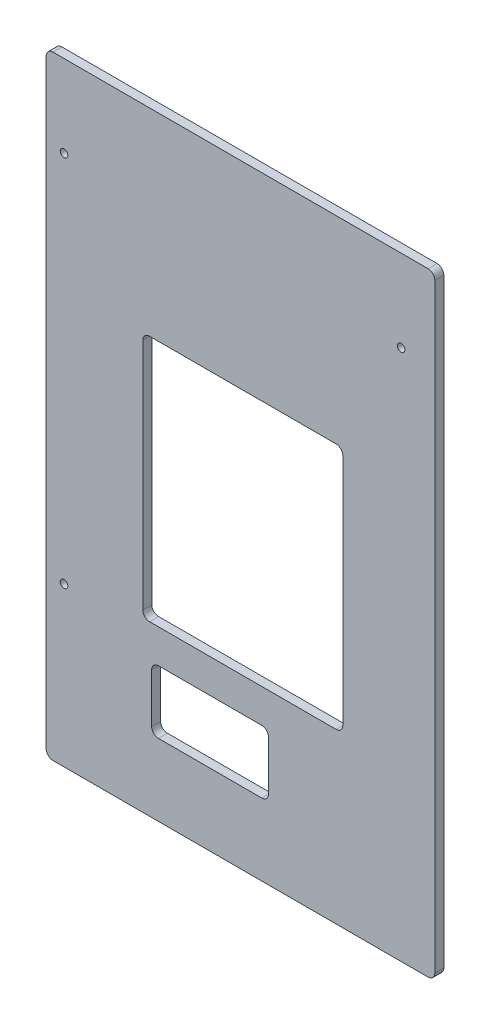
from build123d import *

# Parameters (mm, degrees)
ESQUISSE1_W        = 172.93
ESQUISSE1_H        = 273
ESQUISSE1_R        = 1.5
ESQUISSE1_W_2      = 89
ESQUISSE1_H_2      = 110
ESQUISSE1_W_3      = 52
ESQUISSE1_H_3      = 28
BOSS_EXTRU_1_DEPTH = 4
CONG_1_R           = 3
D_GAGEMENT_M31_D   = 3.4


with BuildPart() as part:
    # Esquisse1 → Boss.-Extru.1 (new body)
    with BuildSketch(Plane.XY):
        with Locations((86.465, 136.5)):
            Rectangle(ESQUISSE1_W, ESQUISSE1_H)
        with Locations((7.93, 236.5)):
            Circle(ESQUISSE1_R, mode=Mode.SUBTRACT)
        with Locations((7.93, 70.5)):
            Circle(ESQUISSE1_R, mode=Mode.SUBTRACT)
        with Locations((157.93, 236.5)):
            Circle(ESQUISSE1_R, mode=Mode.SUBTRACT)
        with Locations((87.5, 130)):
            Rectangle(ESQUISSE1_W_2, ESQUISSE1_H_2, mode=Mode.SUBTRACT)
        with Locations((72.93, 46)):
            Rectangle(ESQUISSE1_W_3, ESQUISSE1_H_3, mode=Mode.SUBTRACT)
    extrude(amount=BOSS_EXTRU_1_DEPTH)

    # Congé1
    cong_1_edges = [part.edges().sort_by_distance(p)[0] for p in [
        (0, 0, 2),
        (172.93, 0, 2),
        (172.93, 273, 2),
        (0, 273, 2),
        (43, 75, 2),
        (132, 75, 2),
        (132, 185, 2),
        (43, 185, 2),
        (98.93, 32, 2),
        (46.93, 32, 2),
        (98.93, 60, 2),
        (46.93, 60, 2),
    ]]
    fillet(cong_1_edges, radius=CONG_1_R)

    # Dégagement M31 (through all)
    with Locations(Plane.XY.offset(4)):
        with Locations((7.93, 236.5), (7.93, 70.5), (157.93, 236.5)):
            Hole(D_GAGEMENT_M31_D / 2)


solid = part.part
